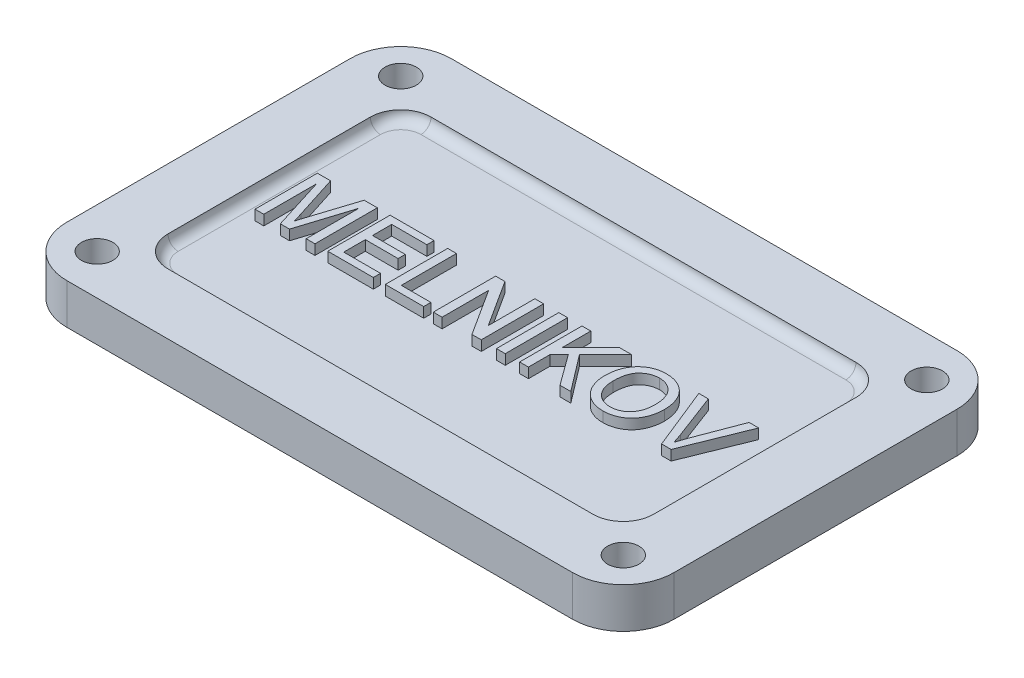
from build123d import *

# Parameters (mm, degrees)
SKETCH_1_W          = 120
SKETCH_1_H          = 76
EXTRUDE_1_DEPTH     = 8
FILLET_1_R          = 10
SKETCH_2_W          = 96
SKETCH_2_H          = 52
CUT_EXTRUDE_1_DEPTH = 2
FILLET_2_R          = 6
SKETCH_3_R          = 3.1
CUT_EXTRUDE_2_DEPTH = 32
SKETCH_4_W          = 1.738554186
SKETCH_4_H          = 12.327929687
EXTRUDE_2_DEPTH     = 2
SKETCH_5_W          = 96
SKETCH_5_H          = 52
CUT_EXTRUDE_3_DEPTH = 2
FILLET_3_R          = 6
FILLET_8_R          = 2


with BuildPart() as part:
    # Эскиз1 → Бобышка-Вытянуть1 (new body)
    with BuildSketch(Plane(origin=(0, 0, 0), x_dir=(1, 0, 0), z_dir=(0, 1, 0))):
        with Locations((60, 38)):
            Rectangle(SKETCH_1_W, SKETCH_1_H)
    extrude(amount=EXTRUDE_1_DEPTH)

    # Скругление1
    fillet_1_edges = [part.edges().sort_by_distance(p)[0] for p in [
        (0, 4, -76),
        (120, 4, -76),
        (120, 4, 0),
        (0, 4, 0),
    ]]
    fillet(fillet_1_edges, radius=FILLET_1_R)

    # Эскиз2 → Вырез-Вытянуть1 (cut)
    with BuildSketch(Plane(origin=(0, 8, 0), x_dir=(1, 0, 0), z_dir=(0, 1, 0))):
        with Locations((60, 38)):
            Rectangle(SKETCH_2_W, SKETCH_2_H)
    extrude(amount=-CUT_EXTRUDE_1_DEPTH, mode=Mode.SUBTRACT)

    # Скругление2
    fillet_2_edges = [part.edges().sort_by_distance(p)[0] for p in [
        (12, 7, -12),
        (12, 7, -64),
        (108, 7, -64),
        (108, 7, -12),
    ]]
    fillet(fillet_2_edges, radius=FILLET_2_R)

    # Эскиз3 → Вырез-Вытянуть2 (cut)
    with BuildSketch(Plane(origin=(0, 8, 0), x_dir=(1, 0, 0), z_dir=(0, 1, 0))):
        with Locations(Location((8, 68, 0), (0, 0, 270))):
            Circle(SKETCH_3_R)
        with Locations(Location((112, 68, 0), (0, 0, 270))):
            Circle(SKETCH_3_R)
        with Locations(Location((112, 8, 0), (0, 0, 270))):
            Circle(SKETCH_3_R)
        with Locations(Location((8, 8, 0), (0, 0, 270))):
            Circle(SKETCH_3_R)
    extrude(amount=-CUT_EXTRUDE_2_DEPTH, mode=Mode.SUBTRACT)

    # Эскиз4 → Бобышка-Вытянуть2 (add)
    # profile 1 of 8: a face of its own
    with BuildSketch(Plane(origin=(0, 6, 0), x_dir=(1, 0, 0), z_dir=(0, 1, 0))):
        with BuildLine():
            Line((16.371563585, 30.82448656), (16.371563585, 43.152416247))
            Line((16.371563585, 43.152416247), (18.986803476, 43.152416247))
            Line((18.986803476, 43.152416247), (21.742806988, 34.501627446))
            add(Edge.make_bspline(
                [(21.742806988, 34.501627446), (21.773136924, 34.403629085), (21.831793254, 34.21410596), (21.918773633, 33.940417127), (21.997911196, 33.686084705), (22.069187033, 33.450299139), (22.136450961, 33.234231095), (22.194690924, 33.036107574), (22.250370223, 32.85813017), (22.283000781, 32.74501971), (22.298452858, 32.691456681)],
                knots=[0, 0, 0, 0, 1.300204174, 2.514519184, 3.639827924, 4.676153899, 5.636536826, 6.507959918, 7.293450077, 8, 8, 8, 8], degree=3))
            add(Edge.make_bspline(
                [(22.298452858, 32.691456681), (22.315662883, 32.749925411), (22.352286918, 32.874350608), (22.411660332, 33.069987901), (22.474835336, 33.286482581), (22.550436451, 33.520113456), (22.629241666, 33.774545461), (22.711957995, 34.049567299), (22.807369669, 34.342433207), (22.870775496, 34.545188777), (22.903489471, 34.649799678)],
                knots=[0, 0, 0, 0, 0.713638162, 1.518667645, 2.393860736, 3.354087503, 4.393659122, 5.512594909, 6.716633584, 8, 8, 8, 8], degree=3))
            Line((22.903489471, 34.649799678), (25.632328074, 43.152416247))
            Line((25.632328074, 43.152416247), (28.22534213, 43.152416247))
            Line((28.22534213, 43.152416247), (28.22534213, 30.82448656))
            Line((28.22534213, 30.82448656), (26.486787944, 30.82448656))
            Line((26.486787944, 30.82448656), (26.486787944, 41.25581168))
            Line((26.486787944, 41.25581168), (23.197364397, 30.82448656))
            Line((23.197364397, 30.82448656), (21.37978502, 30.82448656))
            Line((21.37978502, 30.82448656), (18.110117771, 41.25581168))
            Line((18.110117771, 41.25581168), (18.110117771, 30.82448656))
            Line((18.110117771, 30.82448656), (16.371563585, 30.82448656))
        make_face()
    # profile 2 of 8: a face of its own
    with BuildSketch(Plane(origin=(0, 6, 0), x_dir=(1, 0, 0), z_dir=(0, 1, 0))):
        Polygon((30.75414822, 30.82448656), (30.75414822, 43.152416247), (39.446919154, 43.152416247), (39.446919154, 41.729962822), (32.492702407, 41.729962822), (32.492702407, 37.936753687), (38.972768012, 37.936753687), (38.972768012, 36.514300262), (32.492702407, 36.514300262), (32.492702407, 32.246939985), (39.763019915, 32.246939985), (39.763019915, 30.82448656), align=None)
    # profile 3 of 8: a face of its own
    with BuildSketch(Plane(origin=(0, 6, 0), x_dir=(1, 0, 0), z_dir=(0, 1, 0))):
        Polygon((42.133775624, 30.82448656), (42.133775624, 43.152416247), (43.872329811, 43.152416247), (43.872329811, 32.246939985), (49.720193893, 32.246939985), (49.720193893, 30.82448656), align=None)
    # profile 4 of 8: a face of its own
    with BuildSketch(Plane(origin=(0, 6, 0), x_dir=(1, 0, 0), z_dir=(0, 1, 0))):
        Polygon((51.616798461, 30.82448656), (51.616798461, 43.152416247), (53.454134135, 43.152416247), (59.36126711, 33.953390189), (59.36126711, 43.152416247), (61.099821297, 43.152416247), (61.099821297, 30.82448656), (59.262485622, 30.82448656), (53.355352647, 40.023512619), (53.355352647, 30.82448656), align=None)
    # profile 5 of 8: a face of its own
    with BuildSketch(Plane(origin=(0, 6, 0), x_dir=(1, 0, 0), z_dir=(0, 1, 0))):
        with Locations((64.972055622, 36.988451404)):
            Rectangle(SKETCH_4_W, SKETCH_4_H)
    # profile 6 of 8: a face of its own
    with BuildSketch(Plane(origin=(0, 6, 0), x_dir=(1, 0, 0), z_dir=(0, 1, 0))):
        Polygon((68.686239566, 30.82448656), (68.686239566, 43.152416247), (70.424793753, 43.152416247), (70.424793753, 37.472480694), (76.104729306, 43.152416247), (78.485363164, 43.152416247), (73.333908571, 38.000961654), (78.801463925, 30.82448656), (76.660375175, 30.82448656), (72.232494981, 36.897078527), (70.424793753, 35.091846836), (70.424793753, 30.82448656), align=None)
    # profile 7 of 8: a face of its own
    with BuildSketch(Plane(origin=(0, 6, 0), x_dir=(1, 0, 0), z_dir=(0, 1, 0))):
        with BuildLine():
            add(Edge.make_bspline(
                [(79.433665448, 36.825461949), (79.437950162, 37.072626313), (79.44629871, 37.554213543), (79.524303692, 38.255466604), (79.65096376, 38.915254005), (79.832035536, 39.533524344), (80.061544532, 40.111246455), (80.34055656, 40.649728502), (80.677464117, 41.142875255), (81.058592417, 41.595381151), (81.484295222, 41.99542953), (81.937547713, 42.350729806), (82.424009593, 42.647092242), (82.939186326, 42.891789911), (83.485266676, 43.079661695), (84.060717417, 43.211189039), (84.664923106, 43.296036958), (85.077911835, 43.305586874), (85.288938142, 43.310466628)],
                knots=[0, 0, 0, 0, 1.203621547, 2.345195544, 3.432004029, 4.472479546, 5.478447225, 6.455936844, 7.420185704, 8.381829745, 9.332027588, 10.260832629, 11.182364398, 12.100723901, 13.034044877, 13.989196293, 14.972532542, 16, 16, 16, 16], degree=3))
            add(Edge.make_bspline(
                [(85.288938142, 43.310466628), (85.428124492, 43.308036172), (85.704523409, 43.303209727), (86.113154539, 43.266486923), (86.511285286, 43.200943079), (86.898523591, 43.113106979), (87.275923519, 42.997869835), (87.643710447, 42.861835893), (87.99866481, 42.693270685), (88.343148026, 42.50454516), (88.673093725, 42.2934475), (88.983175867, 42.060248343), (89.272651706, 41.806711365), (89.54540969, 41.537004022), (89.792348267, 41.242024068), (90.023669099, 40.930757097), (90.232725045, 40.597683841), (90.420257882, 40.245533273), (90.587931295, 39.879744294), (90.731240605, 39.498800856), (90.854297695, 39.107272643), (90.957306861, 38.702842227), (91.031218716, 38.285647869), (91.090075526, 37.857487218), (91.121053491, 37.416960902), (91.126590121, 37.119377526), (91.129393613, 36.968695106)],
                knots=[0, 0, 0, 0, 1.034375294, 2.054082248, 3.045783978, 4.031219655, 5.002789406, 5.976610191, 6.94273282, 7.920236376, 8.894345378, 9.851183672, 10.800797181, 11.752517031, 12.698794154, 13.65688337, 14.632873302, 15.61821402, 16.620222298, 17.621258913, 18.640965868, 19.669244166, 20.720417492, 21.788124603, 22.880008887, 24, 24, 24, 24], degree=3))
            add(Edge.make_bspline(
                [(91.129393613, 36.968695106), (91.126825003, 36.81552793), (91.121750273, 36.512919763), (91.087412569, 36.065874914), (91.027034951, 35.631663796), (90.94695432, 35.208991669), (90.839648719, 34.798738449), (90.712132503, 34.399727915), (90.557894435, 34.014336653), (90.383699662, 33.641635791), (90.186598349, 33.286751258), (89.969182227, 32.952164575), (89.731297271, 32.641005535), (89.476556925, 32.349457013), (89.199012327, 32.08273244), (88.90208106, 31.838337746), (88.586904822, 31.613968011), (88.252424783, 31.41569987), (87.904643641, 31.241910762), (87.550443439, 31.087728513), (87.189561068, 30.956235756), (86.820763142, 30.849673946), (86.445055706, 30.769148172), (86.063496046, 30.708849623), (85.674833357, 30.674129511), (85.413304489, 30.669013801), (85.28152953, 30.666436179)],
                knots=[0, 0, 0, 0, 1.141429366, 2.255090526, 3.338676798, 4.407031443, 5.458968682, 6.496860253, 7.526652771, 8.550250826, 9.560787671, 10.54935636, 11.521089193, 12.477323897, 13.431786008, 14.386110112, 15.340986122, 16.312041, 17.28047646, 18.236612773, 19.189437236, 20.140779471, 21.09494583, 22.051062463, 23.018000708, 24, 24, 24, 24], degree=3))
            add(Edge.make_bspline(
                [(85.28152953, 30.666436179), (85.139842182, 30.668532461), (84.85919503, 30.672684671), (84.44439098, 30.714130798), (84.039906603, 30.77735831), (83.646917807, 30.868639734), (83.265961596, 30.987722802), (82.896587211, 31.131857179), (82.537495523, 31.299116555), (82.193142266, 31.494290112), (81.864699478, 31.711302128), (81.555350544, 31.949073846), (81.265266525, 32.205413988), (80.99910208, 32.484559552), (80.748236981, 32.776391401), (80.522701942, 33.091756745), (80.31513134, 33.423503428), (80.13166753, 33.774829345), (79.965935434, 34.135294421), (79.826302563, 34.505013959), (79.703592331, 34.878539276), (79.605866053, 35.258172626), (79.527990101, 35.643038281), (79.475624167, 36.032495839), (79.437805091, 36.427125329), (79.435052273, 36.692014887), (79.433665448, 36.825461949)],
                knots=[0, 0, 0, 0, 1.072727997, 2.12480551, 3.153819198, 4.171534612, 5.177148798, 6.173931848, 7.17235114, 8.174500385, 9.168706755, 10.151274001, 11.127173509, 12.097141049, 13.070188938, 14.039134204, 15.03036519, 16.031505612, 17.038625933, 18.033164522, 19.022845559, 20.014762458, 21.000193215, 21.994692725, 22.989758729, 24, 24, 24, 24], degree=3))
        make_face()
        with BuildLine():
            add(Edge.make_bspline(
                [(81.172219634, 36.805705651), (81.174883886, 36.627725008), (81.180078989, 36.280675314), (81.239513782, 35.774695316), (81.329696587, 35.297277421), (81.454004063, 34.847081401), (81.621103754, 34.428559629), (81.820893069, 34.037690518), (82.060098962, 33.677072342), (82.333443839, 33.347713892), (82.634091868, 33.051842941), (82.955364797, 32.793415403), (83.297334849, 32.57700062), (83.656210675, 32.398304018), (84.034569915, 32.258815026), (84.431279378, 32.16086937), (84.846630543, 32.099612312), (85.129848817, 32.092508371), (85.274120919, 32.088889605)],
                knots=[0, 0, 0, 0, 1.215430442, 2.370003584, 3.475209778, 4.53279855, 5.55522989, 6.548792651, 7.526809858, 8.505409025, 9.467826767, 10.404123909, 11.316848639, 12.227335424, 13.138360512, 14.065900994, 15.014765094, 16, 16, 16, 16], degree=3))
            add(Edge.make_bspline(
                [(85.274120919, 32.088889605), (85.420838439, 32.092561895), (85.708110931, 32.099752228), (86.129724079, 32.159939931), (86.530303766, 32.262406929), (86.913820453, 32.398813716), (87.273340529, 32.583212438), (87.617272141, 32.799142333), (87.93623967, 33.06300248), (88.238072866, 33.35939671), (88.50879691, 33.696303189), (88.749007507, 34.065422838), (88.944137688, 34.472291512), (89.112606262, 34.907946451), (89.235968662, 35.3806217), (89.327141035, 35.884943891), (89.382083437, 36.42253527), (89.387869155, 36.791581777), (89.390839426, 36.981042792)],
                knots=[0, 0, 0, 0, 0.976878588, 1.912725521, 2.8289017, 3.727303729, 4.617335839, 5.514666588, 6.426584173, 7.368641557, 8.327632997, 9.299405846, 10.294892156, 11.327373912, 12.405931897, 13.542618837, 14.738430195, 16, 16, 16, 16], degree=3))
            add(Edge.make_bspline(
                [(89.390839426, 36.981042792), (89.389789734, 37.102929677), (89.387730617, 37.342027637), (89.360461008, 37.694460766), (89.325286711, 38.035931206), (89.271733298, 38.36599834), (89.197929901, 38.683295282), (89.116168269, 38.990237623), (89.013928208, 39.284180301), (88.89792261, 39.566276047), (88.76811431, 39.835076636), (88.621707811, 40.08831597), (88.460404659, 40.325009513), (88.288556999, 40.549644733), (88.096648881, 40.753527328), (87.893920793, 40.945269393), (87.675767775, 41.120909495), (87.444366913, 41.280493514), (87.203000929, 41.424144281), (86.952167397, 41.547090699), (86.695862452, 41.655083681), (86.429795912, 41.737864834), (86.157641643, 41.804629049), (85.878299453, 41.855342688), (85.590732498, 41.881604571), (85.396820456, 41.885861651), (85.298816291, 41.888013203)],
                knots=[0, 0, 0, 0, 1.220438779, 2.394059227, 3.538503547, 4.658058814, 5.74010225, 6.800155734, 7.837851593, 8.854470756, 9.853724944, 10.825214244, 11.781044712, 12.72106398, 13.654479919, 14.581868691, 15.514082315, 16.456304431, 17.39516604, 18.324312202, 19.252140633, 20.177768678, 21.111585046, 22.057694709, 23.018348693, 24, 24, 24, 24], degree=3))
            add(Edge.make_bspline(
                [(85.298816291, 41.888013203), (85.160300772, 41.885262339), (84.886994219, 41.879834579), (84.484654436, 41.819496595), (84.096755263, 41.729343404), (83.72269472, 41.603304439), (83.36567209, 41.436409042), (83.02383767, 41.231734677), (82.694157177, 40.994854305), (82.381829203, 40.719996389), (82.090671216, 40.404251739), (81.844526348, 40.031998473), (81.637068728, 39.612123056), (81.463845437, 39.145689777), (81.331767779, 38.629086417), (81.240485596, 38.064536163), (81.182851889, 37.451444119), (81.175854324, 37.026454581), (81.172219634, 36.805705651)],
                knots=[0, 0, 0, 0, 0.895090134, 1.766112571, 2.624765742, 3.468151641, 4.313618154, 5.168136083, 6.041303099, 6.935189387, 7.854749729, 8.809996334, 9.809869957, 10.877771942, 12.021723904, 13.25217762, 14.572720513, 16, 16, 16, 16], degree=3))
        make_face(mode=Mode.SUBTRACT)
    # profile 8 of 8: a face of its own
    with BuildSketch(Plane(origin=(0, 6, 0), x_dir=(1, 0, 0), z_dir=(0, 1, 0))):
        with BuildLine():
            Line((96.745121199, 30.82448656), (91.773942821, 43.152416247))
            Line((91.773942821, 43.152416247), (93.658199703, 43.152416247))
            Line((93.658199703, 43.152416247), (97.011831216, 34.316412156))
            add(Edge.make_bspline(
                [(97.011831216, 34.316412156), (97.077458461, 34.142118184), (97.205838886, 33.801163227), (97.384865491, 33.295209448), (97.544904498, 32.805926354), (97.641389989, 32.48339314), (97.688484408, 32.325965176)],
                knots=[0, 0, 0, 0, 1.062747156, 2.078952616, 3.062339733, 4, 4, 4, 4], degree=3))
            add(Edge.make_bspline(
                [(97.688484408, 32.325965176), (97.788741488, 32.658870279), (97.990693092, 33.329453538), (98.234804514, 33.985868548), (98.357728988, 34.316412156)],
                knots=[0, 0, 0, 0, 0.992882236, 2, 2, 2, 2], degree=3))
            Line((98.357728988, 34.316412156), (101.718769114, 43.152416247))
            Line((101.718769114, 43.152416247), (103.603025995, 43.152416247))
            Line((103.603025995, 43.152416247), (98.62937808, 30.82448656))
            Line((98.62937808, 30.82448656), (96.745121199, 30.82448656))
        make_face()
    extrude(amount=EXTRUDE_2_DEPTH)

    # Эскиз5 → Вырез-Вытянуть3 (cut)
    with BuildSketch(Plane.XZ):
        with Locations((60, -38)):
            Rectangle(SKETCH_5_W, SKETCH_5_H)
    extrude(amount=-CUT_EXTRUDE_3_DEPTH, mode=Mode.SUBTRACT)

    # Скругление3
    fillet_3_edges = [part.edges().sort_by_distance(p)[0] for p in [
        (12, 1, -64),
        (12, 1, -12),
        (108, 1, -12),
        (108, 1, -64),
    ]]
    fillet(fillet_3_edges, radius=FILLET_3_R)

    # Скругление8
    fillet_8_edges = [part.edges().sort_by_distance(p)[0] for p in [
        (106.242640687, 6, -62.242640687),
        (13.757359313, 6, -13.757359313),
        (60, 6, -12),
        (106.242640687, 6, -13.757359313),
        (108, 6, -38),
        (60, 6, -64),
        (12, 6, -38),
        (13.757359313, 6, -62.242640687),
        (13.757359313, 2, -62.242640687),
        (60, 2, -64),
        (12, 2, -38),
        (106.242640687, 2, -62.242640687),
        (108, 2, -38),
        (106.242640687, 2, -13.757359313),
        (60, 2, -12),
        (13.757359313, 2, -13.757359313),
    ]]
    fillet(fillet_8_edges, radius=FILLET_8_R - 0.0001)  # a hair under: the kernel refuses the full size


solid = part.part
